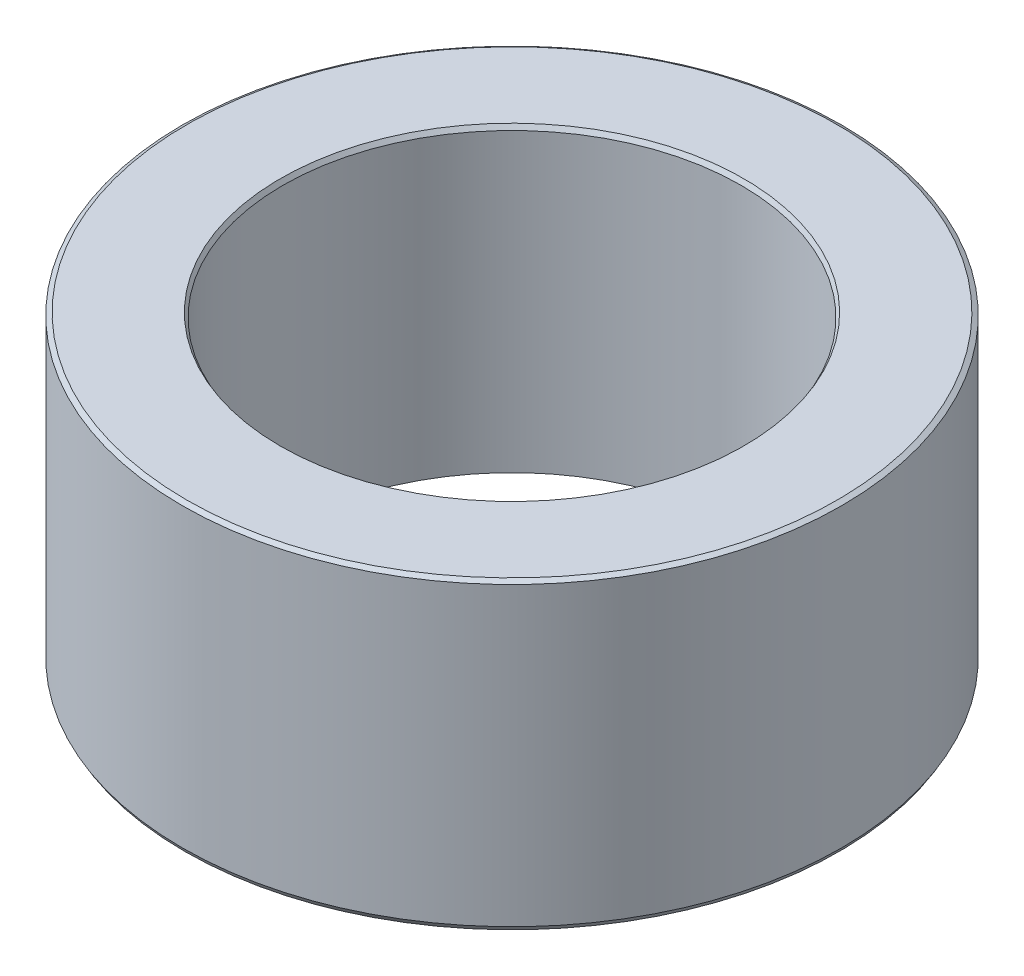
from build123d import *
from OCP.BRepFilletAPI import BRepFilletAPI_MakeChamfer

# Parameters (mm, degrees)
SKETCH1_R           = 52.5
BOSS_EXTRUDE1_DEPTH = 48.31631908
SKETCH2_R           = 36.479326479
CUT_EXTRUDE1_DEPTH  = 89.583106118
CHAMFER1_SIZE       = 0.413235353
CHAMFER1_SIZE2      = 0.715744627


with BuildPart() as part:
    # Sketch1 → Boss-Extrude1 (new body)
    with BuildSketch(Plane(origin=(0, 0, 0), x_dir=(1, 0, 0), z_dir=(0, 1, 0))):
        Circle(SKETCH1_R)
    extrude(amount=BOSS_EXTRUDE1_DEPTH)

    # Sketch2 → Cut-Extrude1 (cut, through all)
    with BuildSketch(Plane(origin=(0, 0, 0), x_dir=(1, 0, 0), z_dir=(0, 1, 0))):
        Circle(SKETCH2_R)
    extrude(amount=CUT_EXTRUDE1_DEPTH, mode=Mode.SUBTRACT)

    # Chamfer1: one chamfer whose edges measure the first distance from different faces: ONE call of the kernel's chamfer builder (chamfer() names one face for all edges)
    chamfer1_edges_1 = [part.edges().sort_by_distance(p)[0] for p in [
        (-36.479326479, 48.31631908, 0),
    ]]
    chamfer1_side_1 = [part.faces().sort_by_distance(p)[0] for p in [
        (-51.01507576, 48.31631908, 0),
    ]]
    chamfer1_edges_2 = [part.edges().sort_by_distance(p)[0] for p in [
        (-36.479326479, 0, 0),
    ]]
    chamfer1_side_2 = [part.faces().sort_by_distance(p)[0] for p in [
        (-36.479326479, 24.15815954, 0),
    ]]
    chamfer1_edges_3 = [part.edges().sort_by_distance(p)[0] for p in [
        (-52.5, 0, 0),
    ]]
    chamfer1_side_3 = [part.faces().sort_by_distance(p)[0] for p in [
        (-51.01507576, 0, 0),
    ]]
    chamfer1_edges_4 = [part.edges().sort_by_distance(p)[0] for p in [
        (-52.5, 48.31631908, 0),
    ]]
    chamfer1_side_4 = [part.faces().sort_by_distance(p)[0] for p in [
        (-52.5, 24.15815954, 0),
    ]]
    chamfer1 = BRepFilletAPI_MakeChamfer(part.part.solid().wrapped)
    for e in chamfer1_edges_1:
        chamfer1.Add(CHAMFER1_SIZE, CHAMFER1_SIZE2, e.wrapped, chamfer1_side_1[0].wrapped)  # the first distance lies on this face
    for e in chamfer1_edges_2:
        chamfer1.Add(CHAMFER1_SIZE, CHAMFER1_SIZE2, e.wrapped, chamfer1_side_2[0].wrapped)  # the first distance lies on this face
    for e in chamfer1_edges_3:
        chamfer1.Add(CHAMFER1_SIZE, CHAMFER1_SIZE2, e.wrapped, chamfer1_side_3[0].wrapped)  # the first distance lies on this face
    for e in chamfer1_edges_4:
        chamfer1.Add(CHAMFER1_SIZE, CHAMFER1_SIZE2, e.wrapped, chamfer1_side_4[0].wrapped)  # the first distance lies on this face
    add(Compound.cast(chamfer1.Shape()), mode=Mode.REPLACE)


solid = part.part
